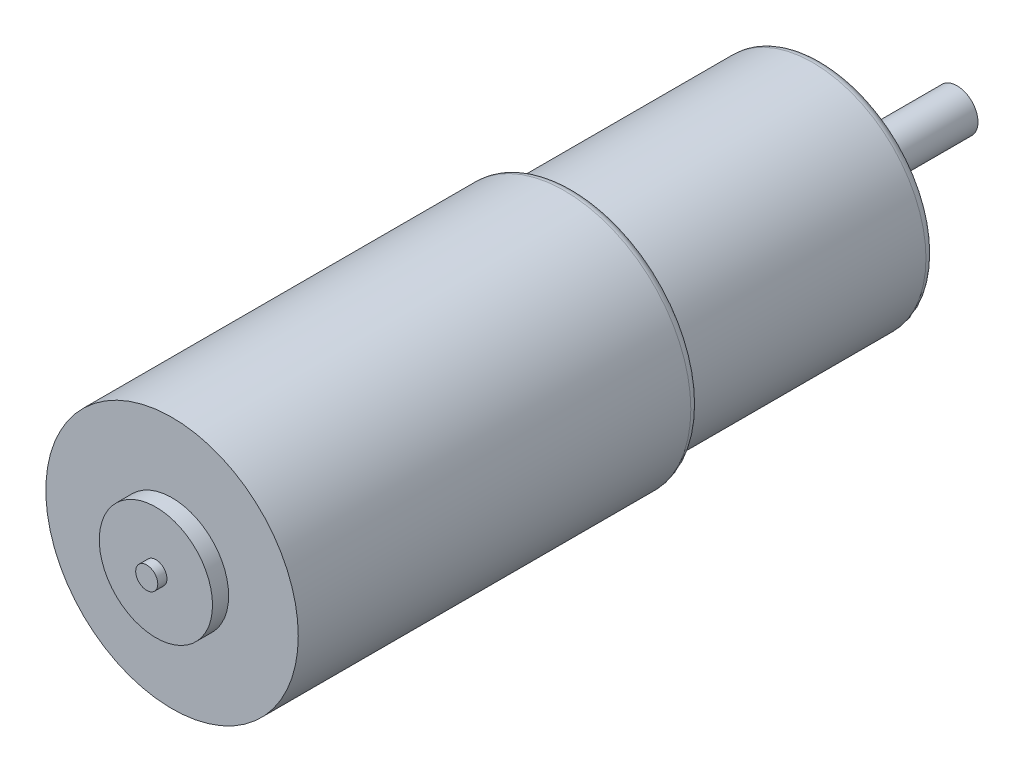
from build123d import *

# Parameters (mm, degrees)
CUT_EXTRUDE1_START = -2.9464
CUT_EXTRUDE1_DEPTH = 2.9464
CUT_EXTRUDE2_DEPTH = 11.811


# Read off the part's stored shape, not the designer's step: #4-40 Tapped Hole1
with BuildPart() as part:
    # Sketch1 → Revolve1 (revolve)
    with BuildSketch(Plane(origin=(0, 0, 0), x_dir=(0, 0, -1), z_dir=(1, 0, 0)), mode=Mode.PRIVATE) as revolve1_sk:
        with BuildLine():
            Line((111.125, 0), (111.125, 2.9718))
            Line((111.125, 2.9718), (94.9452, 2.9718))
            Line((94.9452, 2.9718), (94.9452, 9.9441))
            Line((94.9452, 9.9441), (91.9988, 9.9441))
            Line((91.9988, 9.9441), (91.9988, 14.732))
            ThreePointArc((91.9988, 14.732), (91.626825612, 15.630025612), (90.7288, 16.002))
            Line((90.7288, 16.002), (56.8452, 16.002))
            Line((56.8452, 16.002), (56.8452, 16.5989))
            ThreePointArc((56.8452, 16.5989), (56.473225612, 17.496925612), (55.5752, 17.8689))
            Line((55.5752, 17.8689), (0, 17.8689))
            Line((0, 17.8689), (0, 8.0137))
            Line((0, 8.0137), (-2.286, 8.0137))
            Line((-2.286, 8.0137), (-2.286, 1.5621))
            Line((-2.286, 1.5621), (-3.5814, 1.5621))
            Line((-3.5814, 1.5621), (-3.5814, 0))
            Line((-3.5814, 0), (111.125, 0))
        make_face()
    revolve(revolve1_sk.sketch.rotate(Axis((0, 0, 3.5814), (0, 0, -1)), 90), axis=Axis((0, 0, 3.5814), (0, 0, -1)))

    # #4-40 Tapped Hole1 outline → #4-40 Tapped Hole1 (revolve, cut)
    with BuildSketch(Plane(origin=(-9, -9, 0), x_dir=(1, 0, 0), z_dir=(0, -1, 0))):
        Polygon((1.1303, -86.9188), (0, -86.239647242), (0, -91.9988), (1.1303, -91.9988), align=None)
    revolve(axis=Axis((-9, -9, 0), (0, 0, 1)), mode=Mode.SUBTRACT)

    # 4-40 Tapped Hole1 2 outline → 4-40 Tapped Hole1 2 (revolve, cut)
    with BuildSketch(Plane(origin=(9, 9, 0), x_dir=(1, 0, 0), z_dir=(0, -1, 0))):
        Polygon((1.1303, -86.9188), (0, -86.239647242), (0, -91.9988), (1.1303, -91.9988), align=None)
    revolve(axis=Axis((9, 9, 0), (0, 0, 1)), mode=Mode.SUBTRACT)

    # 4-40 Tapped Hole1 3 outline → 4-40 Tapped Hole1 3 (revolve, cut)
    with BuildSketch(Plane(origin=(9, -9, 0), x_dir=(1, 0, 0), z_dir=(0, -1, 0))):
        Polygon((1.1303, -86.9188), (0, -86.239647242), (0, -91.9988), (1.1303, -91.9988), align=None)
    revolve(axis=Axis((9, -9, 0), (0, 0, 1)), mode=Mode.SUBTRACT)

    # 4-40 Tapped Hole1 4 outline → 4-40 Tapped Hole1 4 (revolve, cut)
    with BuildSketch(Plane(origin=(-9, 9, 0), x_dir=(1, 0, 0), z_dir=(0, -1, 0))):
        Polygon((1.1303, -86.9188), (0, -86.239647242), (0, -91.9988), (1.1303, -91.9988), align=None)
    revolve(axis=Axis((-9, 9, 0), (0, 0, 1)), mode=Mode.SUBTRACT)

    # Sketch5 → Cut-Extrude1 (cut)
    with BuildSketch(Plane(origin=(0, 0, -94.9452), x_dir=(-1, 0, 0), z_dir=(0, 0, -1)).offset(CUT_EXTRUDE1_START)):
        with BuildLine():
            Line((-9.017, -4.192712226), (-9.017, 4.192712226))
            ThreePointArc((-9.017, 4.192712226), (-9.9441, 0), (-9.017, -4.192712226))
        make_face()
        with BuildLine():
            ThreePointArc((9.9441, 0), (9.709559066, 2.146995006), (9.017, 4.192712226))
            Line((9.017, 4.192712226), (9.017, -4.192712226))
            ThreePointArc((9.017, -4.192712226), (9.709559066, -2.146995006), (9.9441, 0))
        make_face()
    extrude(amount=CUT_EXTRUDE1_DEPTH, mode=Mode.SUBTRACT)

    # Sketch6 → Cut-Extrude2 (cut)
    with BuildSketch(Plane(origin=(0, 0, -111.125), x_dir=(-1, 0, 0), z_dir=(0, 0, -1))):
        Polygon((2.280914343, 68.368161202), (2.280914343, 1.905), (2.280914343, -1.905), (2.280914343, -68.368161202), (135.207236746, -68.368161202), (135.207236746, 68.368161202), align=None)
    extrude(amount=-CUT_EXTRUDE2_DEPTH, mode=Mode.SUBTRACT)


solid = part.part
